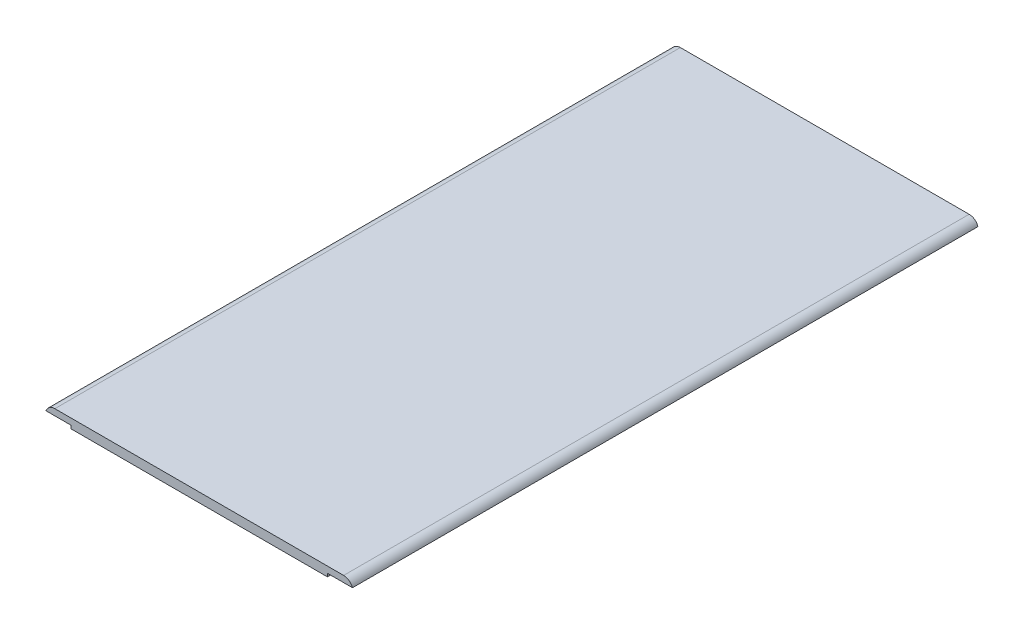
from build123d import *

# Parameters (mm, degrees)
SKIZZE2_W                       = 98
SKIZZE2_H                       = 200
AUFSATZ_LINEAR_AUSTRAGEN2_DEPTH = 1.5
SKIZZE4_W                       = 8
SKIZZE4_H                       = 200
SCHNITT_LINEAR_AUSTRAGEN1_DEPTH = 1
VERRUNDUNG1_R                   = 3
SKIZZE5_W                       = 25
SKIZZE5_H                       = 30
SCHNITT_LINEAR_AUSTRAGEN2_DEPTH = 2.5
VERRUNDUNG2_R                   = 5


with BuildPart() as part:
    # Skizze2 → Aufsatz-Linear austragen2 (new, symmetric)
    with BuildSketch(Plane(origin=(0, 0, 0), x_dir=(1, 0, 0), z_dir=(0, 1, 0))):
        Rectangle(SKIZZE2_W, SKIZZE2_H)
    extrude(amount=AUFSATZ_LINEAR_AUSTRAGEN2_DEPTH, both=True)

    # Skizze4 → Schnitt-Linear austragen1 (cut)
    with BuildSketch(Plane.XZ.offset(1.5)):
        with Locations((-45, 0)):
            Rectangle(SKIZZE4_W, SKIZZE4_H)
        with Locations((45, 0)):
            Rectangle(SKIZZE4_W, SKIZZE4_H)
    extrude(amount=-SCHNITT_LINEAR_AUSTRAGEN1_DEPTH, mode=Mode.SUBTRACT)

    # Verrundung1
    # the kernel refuses this fillet: 3 mm, written as the material it takes off along each edge
    with BuildSketch(Plane(origin=(-49, 1.5, 107.071067812), x_dir=(0, -1, 0), z_dir=(0, 0, -1))) as verrundung1_piece_1:
        with BuildLine():
            CenterArc((3, -2.828427125), VERRUNDUNG1_R, 109.471220634, 70.528779366)
            Line((0, -2.828427125), (-0.06, -2.828427125))
            Line((-0.06, -2.828427125), (-0.06, 0))
            Line((-0.06, 0), (0, 0.06))
            ThreePointArc((0, 0.06), (1, 0.06), (1.98, 0.056568542))
            Line((1.98, 0.056568542), (2, 0))
        make_face()
    extrude(amount=214.142135624, mode=Mode.SUBTRACT)
    with BuildSketch(Plane(origin=(49, 1.5, -107.071067812), x_dir=(-1, 0, 0), z_dir=(0, 0, 1))) as verrundung1_piece_2:
        with BuildLine():
            CenterArc((2.828427125, 3), VERRUNDUNG1_R, 199.471220634, 70.528779366)
            Line((0, 2), (-0.056568542, 1.98))
            ThreePointArc((-0.056568542, 1.98), (-0.06, 1), (-0.06, 0))
            Line((-0.06, 0), (0, -0.06))
            Line((0, -0.06), (2.828427125, -0.06))
            Line((2.828427125, -0.06), (2.828427125, 0))
        make_face()
    extrude(amount=214.142135624, mode=Mode.SUBTRACT)

    # Skizze5 → Schnitt-Linear austragen2 (cut)
    with BuildSketch(Plane.XZ.offset(1.5)):
        with Locations((0, -80.75)):
            Rectangle(SKIZZE5_W, SKIZZE5_H)
    extrude(amount=-SCHNITT_LINEAR_AUSTRAGEN2_DEPTH, mode=Mode.SUBTRACT)

    # Verrundung2
    verrundung2_edges = [part.edges().sort_by_distance(p)[0] for p in [
        (-12.5, -0.25, -95.75),
        (-12.5, -0.25, -65.75),
        (12.5, -0.25, -65.75),
        (12.5, -0.25, -95.75),
    ]]
    fillet(verrundung2_edges, radius=VERRUNDUNG2_R)


solid = part.part
